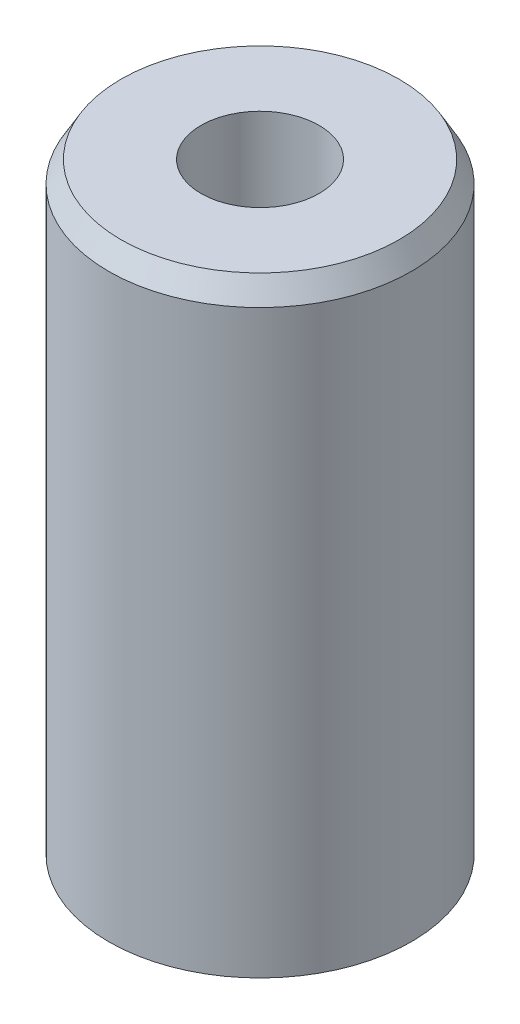
from build123d import *
from OCP.BRepFilletAPI import BRepFilletAPI_MakeChamfer

# Parameters (mm, degrees)
SKETCH1_R           = 25
BOSS_EXTRUDE1_DEPTH = 101.440218568
SKETCH2_R           = 9.755559429
CUT_EXTRUDE1_DEPTH  = 108.424940973
CHAMFER1_SIZE       = 3.517008271
CHAMFER1_SIZE2      = 2.030545672


with BuildPart() as part:
    # Sketch1 → Boss-Extrude1 (new body)
    with BuildSketch(Plane(origin=(0, 0, 0), x_dir=(1, 0, 0), z_dir=(0, 1, 0))):
        Circle(SKETCH1_R)
    extrude(amount=BOSS_EXTRUDE1_DEPTH)

    # Sketch2 → Cut-Extrude1 (cut, through all)
    with BuildSketch(Plane(origin=(0, 0, 0), x_dir=(1, 0, 0), z_dir=(0, 1, 0))):
        Circle(SKETCH2_R)
    extrude(amount=CUT_EXTRUDE1_DEPTH, mode=Mode.SUBTRACT)

    # Chamfer1: one chamfer whose edges measure the first distance from different faces: ONE call of the kernel's chamfer builder (chamfer() names one face for all edges)
    chamfer1_edges_1 = [part.edges().sort_by_distance(p)[0] for p in [
        (-25, 101.440218568, 0),
    ]]
    chamfer1_side_1 = [part.faces().sort_by_distance(p)[0] for p in [
        (-25, 50.720109284, 0),
    ]]
    chamfer1_edges_2 = [part.edges().sort_by_distance(p)[0] for p in [
        (-25, 0, 0),
    ]]
    chamfer1_side_2 = [part.faces().sort_by_distance(p)[0] for p in [
        (-24.292893219, 0, 0),
    ]]
    chamfer1 = BRepFilletAPI_MakeChamfer(part.part.solid().wrapped)
    for e in chamfer1_edges_1:
        chamfer1.Add(CHAMFER1_SIZE, CHAMFER1_SIZE2, e.wrapped, chamfer1_side_1[0].wrapped)  # the first distance lies on this face
    for e in chamfer1_edges_2:
        chamfer1.Add(CHAMFER1_SIZE, CHAMFER1_SIZE2, e.wrapped, chamfer1_side_2[0].wrapped)  # the first distance lies on this face
    add(Compound.cast(chamfer1.Shape()), mode=Mode.REPLACE)


solid = part.part
